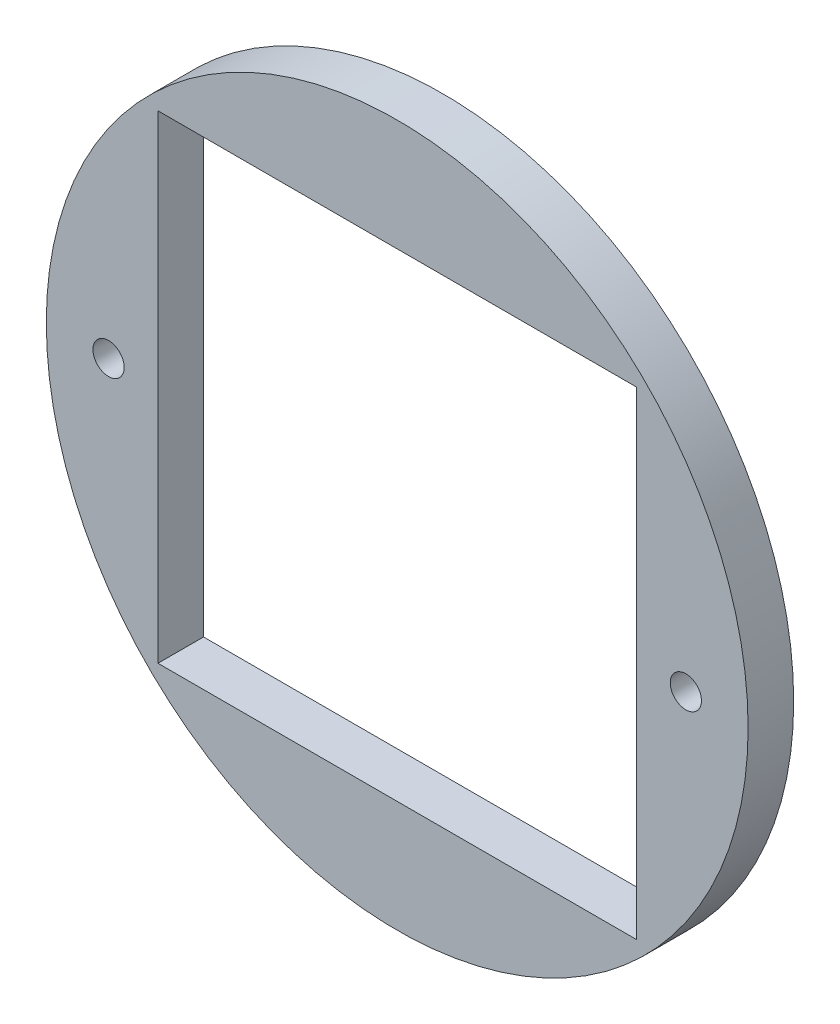
from build123d import *

# Parameters (mm, degrees)
SKETCH1_R               = 73.3425
BOSS_EXTRUDE1_DEPTH     = 9.525
F_1_4_CLEARANCE_HOLE1_D = 6.5278
CUT_EXTRUDE1_DEPTH      = 105.158390145
CUT_EXTRUDE1_DEPTH_BACK = 105.158390145
SKETCH4_W               = 99.999999898
SKETCH4_H               = 99.999999898


with BuildPart() as part:
    # Sketch1 → Boss-Extrude1 (new body)
    with BuildSketch(Plane.XY):
        Circle(SKETCH1_R)
    extrude(amount=BOSS_EXTRUDE1_DEPTH)

    # 1/4 Clearance Hole1 (through all)
    with Locations(Plane.XY.offset(9.525)):
        with Locations((-60.325, 0), (60.325, 0)):
            Hole(F_1_4_CLEARANCE_HOLE1_D / 2)

    # Sketch4 → Cut-Extrude1 (cut, two sides: drawn at the far end of the back side and taken through both)
    with BuildSketch(Plane.XY.offset(9.525).offset(-CUT_EXTRUDE1_DEPTH_BACK)):
        Rectangle(SKETCH4_W, SKETCH4_H)
    extrude(amount=CUT_EXTRUDE1_DEPTH + CUT_EXTRUDE1_DEPTH_BACK, mode=Mode.SUBTRACT)


solid = part.part
